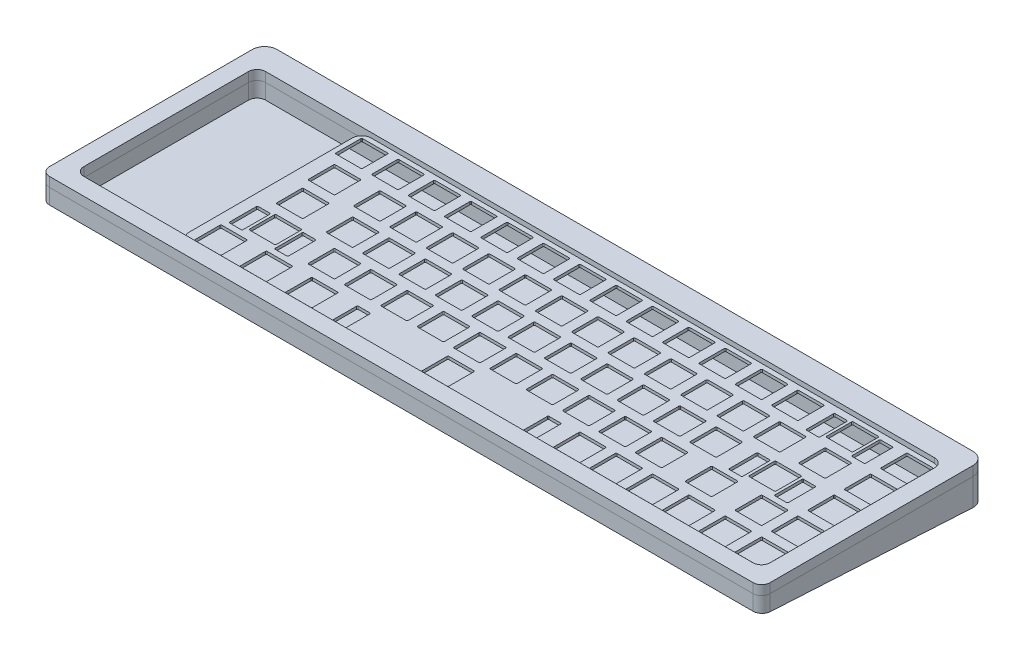
from build123d import *

# Parameters (mm, degrees)
BOSS_EXTRUDE1_DEPTH = 13
SKETCH4_W           = 377.65
SKETCH4_H           = 117.25
BOSS_EXTRUDE3_DEPTH = 10.5
CUT_EXTRUDE3_DEPTH  = 400
FILLET1_R           = 6.5
FILLET4_R           = 4.5
FILLET2_R           = 4.5
SKETCH10_W          = 25
SKETCH10_H          = 7
SKETCH10_H_2        = 7.5
CUT_EXTRUDE2_DEPTH  = 2.5
FILLET3_R           = 4.5
SKETCH9_R           = 1
BOSS_EXTRUDE4_DEPTH = 1.5


with BuildPart() as part:
    # Sketch2 → Boss-Extrude1 (new body)
    with BuildSketch(Plane(origin=(0, 0, 0), x_dir=(1, 0, 0), z_dir=(0, 1, 0))):
        Polygon((-188.825, 60.625), (-188.825, 54.625), (-188.825, -56.625), (188.825, -56.625), (188.825, 60.625), (-182.825, 60.625), align=None)
        Polygon((-179.825, -46.625), (-179.825, 46.625), (-179.825, 47.625), (-178.825, 47.625), (178.825, 47.625), (179.825, 47.625), (179.825, 46.625), (179.825, -46.625), (179.825, -47.625), (178.825, -47.625), (-178.825, -47.625), (-179.825, -47.625), align=None, mode=Mode.SUBTRACT)
    extrude(amount=BOSS_EXTRUDE1_DEPTH)

    # Sketch4 → Boss-Extrude3 (add)
    with BuildSketch(Plane.XZ):
        with Locations((0, -2)):
            Rectangle(SKETCH4_W, SKETCH4_H)
    extrude(amount=BOSS_EXTRUDE3_DEPTH)

    # Sketch12 → Cut-Extrude3 (cut)
    with BuildSketch(Plane.ZY.offset(188.825)):
        Polygon((-60.625, -10.5), (-60.625, -6.5), (56.625, 0), (56.625, -10.5), align=None)
    extrude(amount=-CUT_EXTRUDE3_DEPTH, mode=Mode.SUBTRACT)

    # Fillet1
    fillet1_edges = [part.edges().sort_by_distance(p)[0] for p in [
        (188.825, 3.25, -60.625),
        (-188.825, 3.25, -60.625),
    ]]
    fillet(fillet1_edges, radius=FILLET1_R)

    # Fillet4
    fillet4_edges = [part.edges().sort_by_distance(p)[0] for p in [
        (188.825, 6.5, 56.625),
        (-188.825, 6.5, 56.625),
    ]]
    fillet(fillet4_edges, radius=FILLET4_R)

    # Fillet2
    fillet2_edges = [part.edges().sort_by_distance(p)[0] for p in [
        (179.825, 6.5, 47.625),
        (-179.825, 6.5, 47.625),
        (179.825, 6.5, -47.625),
        (-179.825, 6.5, -47.625),
    ]]
    fillet(fillet2_edges, radius=FILLET2_R)


with BuildPart() as body_2:
    # Split1: the piece on the far side of the plane
    add(part.part)
    split(bisect_by=Plane.ZX.offset(8), keep=Keep.BOTTOM)


with BuildPart() as part_1:
    add(part.part)

    # Split1
    split(bisect_by=Plane.ZX.offset(8), keep=Keep.TOP)

    # Sketch10 → Cut-Extrude2 (cut)
    with BuildSketch(Plane(origin=(0, 8, 0), x_dir=(1, 0, 0), z_dir=(0, 1, 0))):
        Polygon((-108.245613046, 55.125), (-108.245613046, 47.625), (-83.245613046, 47.625), (-83.245613046, 55.125), (-90.245613046, 55.125), align=None)
        with Locations((-93.199035781, -51.125)):
            Rectangle(SKETCH10_W, SKETCH10_H)
        with Locations((-15.745613046, 51.375)):
            Rectangle(SKETCH10_W, SKETCH10_H_2)
        with Locations((-13.199035781, -51.125)):
            Rectangle(SKETCH10_W, SKETCH10_H)
        with Locations((64.254386954, 51.375)):
            Rectangle(SKETCH10_W, SKETCH10_H_2)
        with Locations((66.800964219, -51.125)):
            Rectangle(SKETCH10_W, SKETCH10_H)
        with Locations((144.254386954, 51.375)):
            Rectangle(SKETCH10_W, SKETCH10_H_2)
        with Locations((146.800964219, -51.125)):
            Rectangle(SKETCH10_W, SKETCH10_H)
    extrude(amount=CUT_EXTRUDE2_DEPTH, mode=Mode.SUBTRACT)

    # Fillet3
    fillet3_edges = [part_1.edges().sort_by_distance(p)[0] for p in [
        (-108.245613046, 9.25, -55.125),
        (-28.245613046, 9.25, -55.125),
        (-3.245613046, 9.25, -55.125),
        (-83.245613046, 9.25, -55.125),
        (76.754386954, 9.25, -55.125),
        (51.754386954, 9.25, -55.125),
        (131.754386954, 9.25, -55.125),
        (156.754386954, 9.25, -55.125),
        (134.300964219, 9.25, 54.625),
        (159.300964219, 9.25, 54.625),
        (79.300964219, 9.25, 54.625),
        (54.300964219, 9.25, 54.625),
        (-25.699035781, 9.25, 54.625),
        (-0.699035781, 9.25, 54.625),
        (-80.699035781, 9.25, 54.625),
        (-105.699035781, 9.25, 54.625),
    ]]
    fillet(fillet3_edges, radius=FILLET3_R)


with BuildPart() as body_3:
    # Sketch9 → Boss-Extrude4 (new body)
    with BuildSketch(Plane(origin=(0, 0, 0), x_dir=(1, 0, 0), z_dir=(0, 1, 0))):
        with BuildLine():
            Line((-103.245613046, 47.625), (-119.970321887, 47.625))
            ThreePointArc((-119.970321887, 47.625), (-123.505855793, 46.160533906), (-124.970321887, 42.625))
            Line((-124.970321887, 42.625), (-124.970321887, -42.625))
            ThreePointArc((-124.970321887, -42.625), (-123.505855793, -46.160533906), (-119.970321887, -47.625))
            Line((-119.970321887, -47.625), (-100.699035781, -47.625))
            Line((-100.699035781, -47.625), (-100.699035781, -52.625))
            ThreePointArc((-100.699035781, -52.625), (-100.113249344, -54.039213562), (-98.699035781, -54.625))
            Line((-98.699035781, -54.625), (-87.699035781, -54.625))
            ThreePointArc((-87.699035781, -54.625), (-86.284822219, -54.039213562), (-85.699035781, -52.625))
            Line((-85.699035781, -52.625), (-85.699035781, -47.625))
            Line((-85.699035781, -47.625), (-20.699035781, -47.625))
            Line((-20.699035781, -47.625), (-20.699035781, -52.625))
            ThreePointArc((-20.699035781, -52.625), (-20.113249344, -54.039213562), (-18.699035781, -54.625))
            Line((-18.699035781, -54.625), (-7.699035781, -54.625))
            ThreePointArc((-7.699035781, -54.625), (-6.284822219, -54.039213562), (-5.699035781, -52.625))
            Line((-5.699035781, -52.625), (-5.699035781, -47.625))
            Line((-5.699035781, -47.625), (59.300964219, -47.625))
            Line((59.300964219, -47.625), (59.300964219, -52.625))
            ThreePointArc((59.300964219, -52.625), (59.886750656, -54.039213562), (61.300964219, -54.625))
            Line((61.300964219, -54.625), (72.300964219, -54.625))
            ThreePointArc((72.300964219, -54.625), (73.715177781, -54.039213562), (74.300964219, -52.625))
            Line((74.300964219, -52.625), (74.300964219, -47.625))
            Line((74.300964219, -47.625), (139.300964219, -47.625))
            Line((139.300964219, -47.625), (139.300964219, -52.625))
            ThreePointArc((139.300964219, -52.625), (139.886750656, -54.039213562), (141.300964219, -54.625))
            Line((141.300964219, -54.625), (152.300964219, -54.625))
            ThreePointArc((152.300964219, -54.625), (153.715177781, -54.039213562), (154.300964219, -52.625))
            Line((154.300964219, -52.625), (154.300964219, -47.625))
            Line((154.300964219, -47.625), (174.829678113, -47.625))
            ThreePointArc((174.829678113, -47.625), (178.287915068, -46.2361767), (179.825, -42.841238864))
            Line((179.825, -42.841238864), (179.825, 42.841238864))
            ThreePointArc((179.825, 42.841238864), (178.287915068, 46.2361767), (174.829678113, 47.625))
            Line((174.829678113, 47.625), (151.754386954, 47.625))
            Line((151.754386954, 47.625), (151.754386954, 53.125))
            ThreePointArc((151.754386954, 53.125), (151.168600516, 54.539213562), (149.754386954, 55.125))
            Line((149.754386954, 55.125), (138.754386954, 55.125))
            ThreePointArc((138.754386954, 55.125), (137.340173391, 54.539213562), (136.754386954, 53.125))
            Line((136.754386954, 53.125), (136.754386954, 47.625))
            Line((136.754386954, 47.625), (71.754386954, 47.625))
            Line((71.754386954, 47.625), (71.754386954, 53.125))
            ThreePointArc((71.754386954, 53.125), (71.168600516, 54.539213562), (69.754386954, 55.125))
            Line((69.754386954, 55.125), (58.754386954, 55.125))
            ThreePointArc((58.754386954, 55.125), (57.340173391, 54.539213562), (56.754386954, 53.125))
            Line((56.754386954, 53.125), (56.754386954, 47.625))
            Line((56.754386954, 47.625), (-8.245613046, 47.625))
            Line((-8.245613046, 47.625), (-8.245613046, 53.125))
            ThreePointArc((-8.245613046, 53.125), (-8.831399484, 54.539213562), (-10.245613046, 55.125))
            Line((-10.245613046, 55.125), (-21.245613046, 55.125))
            ThreePointArc((-21.245613046, 55.125), (-22.659826609, 54.539213562), (-23.245613046, 53.125))
            Line((-23.245613046, 53.125), (-23.245613046, 47.625))
            Line((-23.245613046, 47.625), (-88.245613046, 47.625))
            Line((-88.245613046, 47.625), (-88.245613046, 53.125))
            ThreePointArc((-88.245613046, 53.125), (-88.831399484, 54.539213562), (-90.245613046, 55.125))
            Line((-90.245613046, 55.125), (-101.245613046, 55.125))
            ThreePointArc((-101.245613046, 55.125), (-102.659826609, 54.539213562), (-103.245613046, 53.125))
            Line((-103.245613046, 53.125), (-103.245613046, 47.625))
        make_face()
        with BuildLine():
            ThreePointArc((-120.064071887, -31.6), (-119.917625277, -31.246446609), (-119.564071887, -31.1))
            Line((-119.564071887, -31.1), (-106.564071887, -31.1))
            ThreePointArc((-106.564071887, -31.1), (-106.210518496, -31.246446609), (-106.064071887, -31.6))
            Line((-106.064071887, -31.6), (-106.064071887, -44.6))
            ThreePointArc((-106.064071887, -44.6), (-106.210518496, -44.953553391), (-106.564071887, -45.1))
            Line((-106.564071887, -45.1), (-119.564071887, -45.1))
            ThreePointArc((-119.564071887, -45.1), (-119.917625277, -44.953553391), (-120.064071887, -44.6))
            Line((-120.064071887, -44.6), (-120.064071887, -31.6))
        make_face(mode=Mode.SUBTRACT)
        with BuildLine():
            ThreePointArc((-96.251571887, -31.6), (-96.105125277, -31.246446609), (-95.751571887, -31.1))
            Line((-95.751571887, -31.1), (-82.751571887, -31.1))
            ThreePointArc((-82.751571887, -31.1), (-82.398018496, -31.246446609), (-82.251571887, -31.6))
            Line((-82.251571887, -31.6), (-82.251571887, -44.6))
            ThreePointArc((-82.251571887, -44.6), (-82.398018496, -44.953553391), (-82.751571887, -45.1))
            Line((-82.751571887, -45.1), (-95.751571887, -45.1))
            ThreePointArc((-95.751571887, -45.1), (-96.105125277, -44.953553391), (-96.251571887, -44.6))
            Line((-96.251571887, -44.6), (-96.251571887, -31.6))
        make_face(mode=Mode.SUBTRACT)
        with BuildLine():
            ThreePointArc((-72.439071887, -31.6), (-72.292625277, -31.246446609), (-71.939071887, -31.1))
            Line((-71.939071887, -31.1), (-58.939071887, -31.1))
            ThreePointArc((-58.939071887, -31.1), (-58.585518496, -31.246446609), (-58.439071887, -31.6))
            Line((-58.439071887, -31.6), (-58.439071887, -44.6))
            ThreePointArc((-58.439071887, -44.6), (-58.585518496, -44.953553391), (-58.939071887, -45.1))
            Line((-58.939071887, -45.1), (-71.939071887, -45.1))
            ThreePointArc((-71.939071887, -45.1), (-72.292625277, -44.953553391), (-72.439071887, -44.6))
            Line((-72.439071887, -44.6), (-72.439071887, -31.6))
        make_face(mode=Mode.SUBTRACT)
        with BuildLine():
            ThreePointArc((-47.501571887, -32.6), (-47.355125277, -32.246446609), (-47.001571887, -32.1))
            Line((-47.001571887, -32.1), (-41.001571887, -32.1))
            ThreePointArc((-41.001571887, -32.1), (-40.648018496, -32.246446609), (-40.501571887, -32.6))
            Line((-40.501571887, -32.6), (-40.501571887, -46.6))
            ThreePointArc((-40.501571887, -46.6), (-40.648018496, -46.953553391), (-41.001571887, -47.1))
            Line((-41.001571887, -47.1), (-47.001571887, -47.1))
            ThreePointArc((-47.001571887, -47.1), (-47.355125277, -46.953553391), (-47.501571887, -46.6))
            Line((-47.501571887, -46.6), (-47.501571887, -32.6))
        make_face(mode=Mode.SUBTRACT)
        with BuildLine():
            ThreePointArc((-1.001571887, -31.6), (-0.855125277, -31.246446609), (-0.501571887, -31.1))
            Line((-0.501571887, -31.1), (12.498428113, -31.1))
            ThreePointArc((12.498428113, -31.1), (12.851981504, -31.246446609), (12.998428113, -31.6))
            Line((12.998428113, -31.6), (12.998428113, -44.6))
            ThreePointArc((12.998428113, -44.6), (12.851981504, -44.953553391), (12.498428113, -45.1))
            Line((12.498428113, -45.1), (-0.501571887, -45.1))
            ThreePointArc((-0.501571887, -45.1), (-0.855125277, -44.953553391), (-1.001571887, -44.6))
            Line((-1.001571887, -44.6), (-1.001571887, -31.6))
        make_face(mode=Mode.SUBTRACT)
        with BuildLine():
            ThreePointArc((-118.977071887, -13.55), (-118.830625277, -13.196446609), (-118.477071887, -13.05))
            Line((-118.477071887, -13.05), (-112.477071887, -13.05))
            ThreePointArc((-112.477071887, -13.05), (-112.123518496, -13.196446609), (-111.977071887, -13.55))
            Line((-111.977071887, -13.55), (-111.977071887, -27.55))
            ThreePointArc((-111.977071887, -27.55), (-112.123518496, -27.903553391), (-112.477071887, -28.05))
            Line((-112.477071887, -28.05), (-118.477071887, -28.05))
            ThreePointArc((-118.477071887, -28.05), (-118.830625277, -27.903553391), (-118.977071887, -27.55))
            Line((-118.977071887, -27.55), (-118.977071887, -13.55))
        make_face(mode=Mode.SUBTRACT)
        with BuildLine():
            ThreePointArc((-95.101071887, -13.55), (-94.954625277, -13.196446609), (-94.601071887, -13.05))
            Line((-94.601071887, -13.05), (-88.601071887, -13.05))
            ThreePointArc((-88.601071887, -13.05), (-88.247518496, -13.196446609), (-88.101071887, -13.55))
            Line((-88.101071887, -13.55), (-88.101071887, -27.55))
            ThreePointArc((-88.101071887, -27.55), (-88.247518496, -27.903553391), (-88.601071887, -28.05))
            Line((-88.601071887, -28.05), (-94.601071887, -28.05))
            ThreePointArc((-94.601071887, -28.05), (-94.954625277, -27.903553391), (-95.101071887, -27.55))
            Line((-95.101071887, -27.55), (-95.101071887, -13.55))
        make_face(mode=Mode.SUBTRACT)
        with BuildLine():
            ThreePointArc((-110.539071887, -12.55), (-110.392625277, -12.196446609), (-110.039071887, -12.05))
            Line((-110.039071887, -12.05), (-97.039071887, -12.05))
            ThreePointArc((-97.039071887, -12.05), (-96.685518496, -12.196446609), (-96.539071887, -12.55))
            Line((-96.539071887, -12.55), (-96.539071887, -25.55))
            ThreePointArc((-96.539071887, -25.55), (-96.685518496, -25.903553391), (-97.039071887, -26.05))
            Line((-97.039071887, -26.05), (-110.039071887, -26.05))
            ThreePointArc((-110.039071887, -26.05), (-110.392625277, -25.903553391), (-110.539071887, -25.55))
            Line((-110.539071887, -25.55), (-110.539071887, -12.55))
        make_face(mode=Mode.SUBTRACT)
        with BuildLine():
            ThreePointArc((-79.582821887, -12.55), (-79.436375277, -12.196446609), (-79.082821887, -12.05))
            Line((-79.082821887, -12.05), (-66.082821887, -12.05))
            ThreePointArc((-66.082821887, -12.05), (-65.729268496, -12.196446609), (-65.582821887, -12.55))
            Line((-65.582821887, -12.55), (-65.582821887, -25.55))
            ThreePointArc((-65.582821887, -25.55), (-65.729268496, -25.903553391), (-66.082821887, -26.05))
            Line((-66.082821887, -26.05), (-79.082821887, -26.05))
            ThreePointArc((-79.082821887, -26.05), (-79.436375277, -25.903553391), (-79.582821887, -25.55))
            Line((-79.582821887, -25.55), (-79.582821887, -12.55))
        make_face(mode=Mode.SUBTRACT)
        with BuildLine():
            ThreePointArc((-60.532821887, -12.55), (-60.386375277, -12.196446609), (-60.032821887, -12.05))
            Line((-60.032821887, -12.05), (-47.032821887, -12.05))
            ThreePointArc((-47.032821887, -12.05), (-46.679268496, -12.196446609), (-46.532821887, -12.55))
            Line((-46.532821887, -12.55), (-46.532821887, -25.55))
            ThreePointArc((-46.532821887, -25.55), (-46.679268496, -25.903553391), (-47.032821887, -26.05))
            Line((-47.032821887, -26.05), (-60.032821887, -26.05))
            ThreePointArc((-60.032821887, -26.05), (-60.386375277, -25.903553391), (-60.532821887, -25.55))
            Line((-60.532821887, -25.55), (-60.532821887, -12.55))
        make_face(mode=Mode.SUBTRACT)
        with BuildLine():
            ThreePointArc((-115.301571887, 6.5), (-115.155125277, 6.853553391), (-114.801571887, 7))
            Line((-114.801571887, 7), (-101.801571887, 7))
            ThreePointArc((-101.801571887, 7), (-101.448018496, 6.853553391), (-101.301571887, 6.5))
            Line((-101.301571887, 6.5), (-101.301571887, -6.5))
            ThreePointArc((-101.301571887, -6.5), (-101.448018496, -6.853553391), (-101.801571887, -7))
            Line((-101.801571887, -7), (-114.801571887, -7))
            ThreePointArc((-114.801571887, -7), (-115.155125277, -6.853553391), (-115.301571887, -6.5))
            Line((-115.301571887, -6.5), (-115.301571887, 6.5))
        make_face(mode=Mode.SUBTRACT)
        with BuildLine():
            ThreePointArc((-89.107821887, 6.5), (-88.961375277, 6.853553391), (-88.607821887, 7))
            Line((-88.607821887, 7), (-75.607821887, 7))
            ThreePointArc((-75.607821887, 7), (-75.254268496, 6.853553391), (-75.107821887, 6.5))
            Line((-75.107821887, 6.5), (-75.107821887, -6.5))
            ThreePointArc((-75.107821887, -6.5), (-75.254268496, -6.853553391), (-75.607821887, -7))
            Line((-75.607821887, -7), (-88.607821887, -7))
            ThreePointArc((-88.607821887, -7), (-88.961375277, -6.853553391), (-89.107821887, -6.5))
            Line((-89.107821887, -6.5), (-89.107821887, 6.5))
        make_face(mode=Mode.SUBTRACT)
        with BuildLine():
            ThreePointArc((-70.057821887, 6.5), (-69.911375277, 6.853553391), (-69.557821887, 7))
            Line((-69.557821887, 7), (-56.557821887, 7))
            ThreePointArc((-56.557821887, 7), (-56.204268496, 6.853553391), (-56.057821887, 6.5))
            Line((-56.057821887, 6.5), (-56.057821887, -6.5))
            ThreePointArc((-56.057821887, -6.5), (-56.204268496, -6.853553391), (-56.557821887, -7))
            Line((-56.557821887, -7), (-69.557821887, -7))
            ThreePointArc((-69.557821887, -7), (-69.911375277, -6.853553391), (-70.057821887, -6.5))
            Line((-70.057821887, -6.5), (-70.057821887, 6.5))
        make_face(mode=Mode.SUBTRACT)
        with BuildLine():
            ThreePointArc((-41.482821887, -12.55), (-41.336375277, -12.196446609), (-40.982821887, -12.05))
            Line((-40.982821887, -12.05), (-27.982821887, -12.05))
            ThreePointArc((-27.982821887, -12.05), (-27.629268496, -12.196446609), (-27.482821887, -12.55))
            Line((-27.482821887, -12.55), (-27.482821887, -25.55))
            ThreePointArc((-27.482821887, -25.55), (-27.629268496, -25.903553391), (-27.982821887, -26.05))
            Line((-27.982821887, -26.05), (-40.982821887, -26.05))
            ThreePointArc((-40.982821887, -26.05), (-41.336375277, -25.903553391), (-41.482821887, -25.55))
            Line((-41.482821887, -25.55), (-41.482821887, -12.55))
        make_face(mode=Mode.SUBTRACT)
        with BuildLine():
            ThreePointArc((-22.432821887, -12.55), (-22.286375277, -12.196446609), (-21.932821887, -12.05))
            Line((-21.932821887, -12.05), (-8.932821887, -12.05))
            ThreePointArc((-8.932821887, -12.05), (-8.579268496, -12.196446609), (-8.432821887, -12.55))
            Line((-8.432821887, -12.55), (-8.432821887, -25.55))
            ThreePointArc((-8.432821887, -25.55), (-8.579268496, -25.903553391), (-8.932821887, -26.05))
            Line((-8.932821887, -26.05), (-21.932821887, -26.05))
            ThreePointArc((-21.932821887, -26.05), (-22.286375277, -25.903553391), (-22.432821887, -25.55))
            Line((-22.432821887, -25.55), (-22.432821887, -12.55))
        make_face(mode=Mode.SUBTRACT)
        with BuildLine():
            ThreePointArc((-3.382821887, -12.55), (-3.236375277, -12.196446609), (-2.882821887, -12.05))
            Line((-2.882821887, -12.05), (10.117178113, -12.05))
            ThreePointArc((10.117178113, -12.05), (10.470731504, -12.196446609), (10.617178113, -12.55))
            Line((10.617178113, -12.55), (10.617178113, -25.55))
            ThreePointArc((10.617178113, -25.55), (10.470731504, -25.903553391), (10.117178113, -26.05))
            Line((10.117178113, -26.05), (-2.882821887, -26.05))
            ThreePointArc((-2.882821887, -26.05), (-3.236375277, -25.903553391), (-3.382821887, -25.55))
            Line((-3.382821887, -25.55), (-3.382821887, -12.55))
        make_face(mode=Mode.SUBTRACT)
        with BuildLine():
            ThreePointArc((15.667178113, -12.55), (15.813624723, -12.196446609), (16.167178113, -12.05))
            Line((16.167178113, -12.05), (29.167178113, -12.05))
            ThreePointArc((29.167178113, -12.05), (29.520731504, -12.196446609), (29.667178113, -12.55))
            Line((29.667178113, -12.55), (29.667178113, -25.55))
            ThreePointArc((29.667178113, -25.55), (29.520731504, -25.903553391), (29.167178113, -26.05))
            Line((29.167178113, -26.05), (16.167178113, -26.05))
            ThreePointArc((16.167178113, -26.05), (15.813624723, -25.903553391), (15.667178113, -25.55))
            Line((15.667178113, -25.55), (15.667178113, -12.55))
        make_face(mode=Mode.SUBTRACT)
        with BuildLine():
            ThreePointArc((-51.007821887, 6.5), (-50.861375277, 6.853553391), (-50.507821887, 7))
            Line((-50.507821887, 7), (-37.507821887, 7))
            ThreePointArc((-37.507821887, 7), (-37.154268496, 6.853553391), (-37.007821887, 6.5))
            Line((-37.007821887, 6.5), (-37.007821887, -6.5))
            ThreePointArc((-37.007821887, -6.5), (-37.154268496, -6.853553391), (-37.507821887, -7))
            Line((-37.507821887, -7), (-50.507821887, -7))
            ThreePointArc((-50.507821887, -7), (-50.861375277, -6.853553391), (-51.007821887, -6.5))
            Line((-51.007821887, -6.5), (-51.007821887, 6.5))
        make_face(mode=Mode.SUBTRACT)
        with BuildLine():
            ThreePointArc((-31.957821887, 6.5), (-31.811375277, 6.853553391), (-31.457821887, 7))
            Line((-31.457821887, 7), (-18.457821887, 7))
            ThreePointArc((-18.457821887, 7), (-18.104268496, 6.853553391), (-17.957821887, 6.5))
            Line((-17.957821887, 6.5), (-17.957821887, -6.5))
            ThreePointArc((-17.957821887, -6.5), (-18.104268496, -6.853553391), (-18.457821887, -7))
            Line((-18.457821887, -7), (-31.457821887, -7))
            ThreePointArc((-31.457821887, -7), (-31.811375277, -6.853553391), (-31.957821887, -6.5))
            Line((-31.957821887, -6.5), (-31.957821887, 6.5))
        make_face(mode=Mode.SUBTRACT)
        with BuildLine():
            ThreePointArc((-12.907821887, 6.5), (-12.761375277, 6.853553391), (-12.407821887, 7))
            Line((-12.407821887, 7), (0.592178113, 7))
            ThreePointArc((0.592178113, 7), (0.945731504, 6.853553391), (1.092178113, 6.5))
            Line((1.092178113, 6.5), (1.092178113, -6.5))
            ThreePointArc((1.092178113, -6.5), (0.945731504, -6.853553391), (0.592178113, -7))
            Line((0.592178113, -7), (-12.407821887, -7))
            ThreePointArc((-12.407821887, -7), (-12.761375277, -6.853553391), (-12.907821887, -6.5))
            Line((-12.907821887, -6.5), (-12.907821887, 6.5))
        make_face(mode=Mode.SUBTRACT)
        with BuildLine():
            ThreePointArc((6.142178113, 6.5), (6.288624723, 6.853553391), (6.642178113, 7))
            Line((6.642178113, 7), (19.642178113, 7))
            ThreePointArc((19.642178113, 7), (19.995731504, 6.853553391), (20.142178113, 6.5))
            Line((20.142178113, 6.5), (20.142178113, -6.5))
            ThreePointArc((20.142178113, -6.5), (19.995731504, -6.853553391), (19.642178113, -7))
            Line((19.642178113, -7), (6.642178113, -7))
            ThreePointArc((6.642178113, -7), (6.288624723, -6.853553391), (6.142178113, -6.5))
            Line((6.142178113, -6.5), (6.142178113, 6.5))
        make_face(mode=Mode.SUBTRACT)
        with BuildLine():
            ThreePointArc((52.498428113, -32.6), (52.644874723, -32.246446609), (52.998428113, -32.1))
            Line((52.998428113, -32.1), (58.998428113, -32.1))
            ThreePointArc((58.998428113, -32.1), (59.351981504, -32.246446609), (59.498428113, -32.6))
            Line((59.498428113, -32.6), (59.498428113, -46.6))
            ThreePointArc((59.498428113, -46.6), (59.351981504, -46.953553391), (58.998428113, -47.1))
            Line((58.998428113, -47.1), (52.998428113, -47.1))
            ThreePointArc((52.998428113, -47.1), (52.644874723, -46.953553391), (52.498428113, -46.6))
            Line((52.498428113, -46.6), (52.498428113, -32.6))
        make_face(mode=Mode.SUBTRACT)
        with BuildLine():
            ThreePointArc((68.054678113, -31.6), (68.201124723, -31.246446609), (68.554678113, -31.1))
            Line((68.554678113, -31.1), (81.554678113, -31.1))
            ThreePointArc((81.554678113, -31.1), (81.908231504, -31.246446609), (82.054678113, -31.6))
            Line((82.054678113, -31.6), (82.054678113, -44.6))
            ThreePointArc((82.054678113, -44.6), (81.908231504, -44.953553391), (81.554678113, -45.1))
            Line((81.554678113, -45.1), (68.554678113, -45.1))
            ThreePointArc((68.554678113, -45.1), (68.201124723, -44.953553391), (68.054678113, -44.6))
            Line((68.054678113, -44.6), (68.054678113, -31.6))
        make_face(mode=Mode.SUBTRACT)
        with BuildLine():
            ThreePointArc((87.104678113, -31.6), (87.251124723, -31.246446609), (87.604678113, -31.1))
            Line((87.604678113, -31.1), (100.604678113, -31.1))
            ThreePointArc((100.604678113, -31.1), (100.958231504, -31.246446609), (101.104678113, -31.6))
            Line((101.104678113, -31.6), (101.104678113, -44.6))
            ThreePointArc((101.104678113, -44.6), (100.958231504, -44.953553391), (100.604678113, -45.1))
            Line((100.604678113, -45.1), (87.604678113, -45.1))
            ThreePointArc((87.604678113, -45.1), (87.251124723, -44.953553391), (87.104678113, -44.6))
            Line((87.104678113, -44.6), (87.104678113, -31.6))
        make_face(mode=Mode.SUBTRACT)
        with BuildLine():
            ThreePointArc((106.154678113, -31.6), (106.301124723, -31.246446609), (106.654678113, -31.1))
            Line((106.654678113, -31.1), (119.654678113, -31.1))
            ThreePointArc((119.654678113, -31.1), (120.008231504, -31.246446609), (120.154678113, -31.6))
            Line((120.154678113, -31.6), (120.154678113, -44.6))
            ThreePointArc((120.154678113, -44.6), (120.008231504, -44.953553391), (119.654678113, -45.1))
            Line((119.654678113, -45.1), (106.654678113, -45.1))
            ThreePointArc((106.654678113, -45.1), (106.301124723, -44.953553391), (106.154678113, -44.6))
            Line((106.154678113, -44.6), (106.154678113, -31.6))
        make_face(mode=Mode.SUBTRACT)
        with BuildLine():
            ThreePointArc((125.204678113, -31.6), (125.351124723, -31.246446609), (125.704678113, -31.1))
            Line((125.704678113, -31.1), (138.704678113, -31.1))
            ThreePointArc((138.704678113, -31.1), (139.058231504, -31.246446609), (139.204678113, -31.6))
            Line((139.204678113, -31.6), (139.204678113, -44.6))
            ThreePointArc((139.204678113, -44.6), (139.058231504, -44.953553391), (138.704678113, -45.1))
            Line((138.704678113, -45.1), (125.704678113, -45.1))
            ThreePointArc((125.704678113, -45.1), (125.351124723, -44.953553391), (125.204678113, -44.6))
            Line((125.204678113, -44.6), (125.204678113, -31.6))
        make_face(mode=Mode.SUBTRACT)
        with BuildLine():
            ThreePointArc((144.254678113, -31.6), (144.401124723, -31.246446609), (144.754678113, -31.1))
            Line((144.754678113, -31.1), (157.754678113, -31.1))
            ThreePointArc((157.754678113, -31.1), (158.108231504, -31.246446609), (158.254678113, -31.6))
            Line((158.254678113, -31.6), (158.254678113, -44.6))
            ThreePointArc((158.254678113, -44.6), (158.108231504, -44.953553391), (157.754678113, -45.1))
            Line((157.754678113, -45.1), (144.754678113, -45.1))
            ThreePointArc((144.754678113, -45.1), (144.401124723, -44.953553391), (144.254678113, -44.6))
            Line((144.254678113, -44.6), (144.254678113, -31.6))
        make_face(mode=Mode.SUBTRACT)
        with BuildLine():
            ThreePointArc((163.304678113, -31.6), (163.451124723, -31.246446609), (163.804678113, -31.1))
            Line((163.804678113, -31.1), (176.804678113, -31.1))
            ThreePointArc((176.804678113, -31.1), (177.158231504, -31.246446609), (177.304678113, -31.6))
            Line((177.304678113, -31.6), (177.304678113, -44.6))
            ThreePointArc((177.304678113, -44.6), (177.158231504, -44.953553391), (176.804678113, -45.1))
            Line((176.804678113, -45.1), (163.804678113, -45.1))
            ThreePointArc((163.804678113, -45.1), (163.451124723, -44.953553391), (163.304678113, -44.6))
            Line((163.304678113, -44.6), (163.304678113, -31.6))
        make_face(mode=Mode.SUBTRACT)
        with BuildLine():
            ThreePointArc((34.717178113, -12.55), (34.863624723, -12.196446609), (35.217178113, -12.05))
            Line((35.217178113, -12.05), (48.217178113, -12.05))
            ThreePointArc((48.217178113, -12.05), (48.570731504, -12.196446609), (48.717178113, -12.55))
            Line((48.717178113, -12.55), (48.717178113, -25.55))
            ThreePointArc((48.717178113, -25.55), (48.570731504, -25.903553391), (48.217178113, -26.05))
            Line((48.217178113, -26.05), (35.217178113, -26.05))
            ThreePointArc((35.217178113, -26.05), (34.863624723, -25.903553391), (34.717178113, -25.55))
            Line((34.717178113, -25.55), (34.717178113, -12.55))
        make_face(mode=Mode.SUBTRACT)
        with BuildLine():
            ThreePointArc((53.767178113, -12.55), (53.913624723, -12.196446609), (54.267178113, -12.05))
            Line((54.267178113, -12.05), (67.267178113, -12.05))
            ThreePointArc((67.267178113, -12.05), (67.620731504, -12.196446609), (67.767178113, -12.55))
            Line((67.767178113, -12.55), (67.767178113, -25.55))
            ThreePointArc((67.767178113, -25.55), (67.620731504, -25.903553391), (67.267178113, -26.05))
            Line((67.267178113, -26.05), (54.267178113, -26.05))
            ThreePointArc((54.267178113, -26.05), (53.913624723, -25.903553391), (53.767178113, -25.55))
            Line((53.767178113, -25.55), (53.767178113, -12.55))
        make_face(mode=Mode.SUBTRACT)
        with BuildLine():
            ThreePointArc((72.817178113, -12.55), (72.963624723, -12.196446609), (73.317178113, -12.05))
            Line((73.317178113, -12.05), (86.317178113, -12.05))
            ThreePointArc((86.317178113, -12.05), (86.670731504, -12.196446609), (86.817178113, -12.55))
            Line((86.817178113, -12.55), (86.817178113, -25.55))
            ThreePointArc((86.817178113, -25.55), (86.670731504, -25.903553391), (86.317178113, -26.05))
            Line((86.317178113, -26.05), (73.317178113, -26.05))
            ThreePointArc((73.317178113, -26.05), (72.963624723, -25.903553391), (72.817178113, -25.55))
            Line((72.817178113, -25.55), (72.817178113, -12.55))
        make_face(mode=Mode.SUBTRACT)
        with BuildLine():
            ThreePointArc((91.867178113, -12.55), (92.013624723, -12.196446609), (92.367178113, -12.05))
            Line((92.367178113, -12.05), (105.367178113, -12.05))
            ThreePointArc((105.367178113, -12.05), (105.720731504, -12.196446609), (105.867178113, -12.55))
            Line((105.867178113, -12.55), (105.867178113, -25.55))
            ThreePointArc((105.867178113, -25.55), (105.720731504, -25.903553391), (105.367178113, -26.05))
            Line((105.367178113, -26.05), (92.367178113, -26.05))
            ThreePointArc((92.367178113, -26.05), (92.013624723, -25.903553391), (91.867178113, -25.55))
            Line((91.867178113, -25.55), (91.867178113, -12.55))
        make_face(mode=Mode.SUBTRACT)
        with BuildLine():
            ThreePointArc((25.192178113, 6.5), (25.338624723, 6.853553391), (25.692178113, 7))
            Line((25.692178113, 7), (38.692178113, 7))
            ThreePointArc((38.692178113, 7), (39.045731504, 6.853553391), (39.192178113, 6.5))
            Line((39.192178113, 6.5), (39.192178113, -6.5))
            ThreePointArc((39.192178113, -6.5), (39.045731504, -6.853553391), (38.692178113, -7))
            Line((38.692178113, -7), (25.692178113, -7))
            ThreePointArc((25.692178113, -7), (25.338624723, -6.853553391), (25.192178113, -6.5))
            Line((25.192178113, -6.5), (25.192178113, 6.5))
        make_face(mode=Mode.SUBTRACT)
        with BuildLine():
            ThreePointArc((44.242178113, 6.5), (44.388624723, 6.853553391), (44.742178113, 7))
            Line((44.742178113, 7), (57.742178113, 7))
            ThreePointArc((57.742178113, 7), (58.095731504, 6.853553391), (58.242178113, 6.5))
            Line((58.242178113, 6.5), (58.242178113, -6.5))
            ThreePointArc((58.242178113, -6.5), (58.095731504, -6.853553391), (57.742178113, -7))
            Line((57.742178113, -7), (44.742178113, -7))
            ThreePointArc((44.742178113, -7), (44.388624723, -6.853553391), (44.242178113, -6.5))
            Line((44.242178113, -6.5), (44.242178113, 6.5))
        make_face(mode=Mode.SUBTRACT)
        with BuildLine():
            ThreePointArc((63.292178113, 6.5), (63.438624723, 6.853553391), (63.792178113, 7))
            Line((63.792178113, 7), (76.792178113, 7))
            ThreePointArc((76.792178113, 7), (77.145731504, 6.853553391), (77.292178113, 6.5))
            Line((77.292178113, 6.5), (77.292178113, -6.5))
            ThreePointArc((77.292178113, -6.5), (77.145731504, -6.853553391), (76.792178113, -7))
            Line((76.792178113, -7), (63.792178113, -7))
            ThreePointArc((63.792178113, -7), (63.438624723, -6.853553391), (63.292178113, -6.5))
            Line((63.292178113, -6.5), (63.292178113, 6.5))
        make_face(mode=Mode.SUBTRACT)
        with BuildLine():
            ThreePointArc((82.342178113, 6.5), (82.488624723, 6.853553391), (82.842178113, 7))
            Line((82.842178113, 7), (95.842178113, 7))
            ThreePointArc((95.842178113, 7), (96.195731504, 6.853553391), (96.342178113, 6.5))
            Line((96.342178113, 6.5), (96.342178113, -6.5))
            ThreePointArc((96.342178113, -6.5), (96.195731504, -6.853553391), (95.842178113, -7))
            Line((95.842178113, -7), (82.842178113, -7))
            ThreePointArc((82.842178113, -7), (82.488624723, -6.853553391), (82.342178113, -6.5))
            Line((82.342178113, -6.5), (82.342178113, 6.5))
        make_face(mode=Mode.SUBTRACT)
        with BuildLine():
            ThreePointArc((118.060928113, -12.55), (118.207374723, -12.196446609), (118.560928113, -12.05))
            Line((118.560928113, -12.05), (131.560928113, -12.05))
            ThreePointArc((131.560928113, -12.05), (131.914481504, -12.196446609), (132.060928113, -12.55))
            Line((132.060928113, -12.55), (132.060928113, -25.55))
            ThreePointArc((132.060928113, -25.55), (131.914481504, -25.903553391), (131.560928113, -26.05))
            Line((131.560928113, -26.05), (118.560928113, -26.05))
            ThreePointArc((118.560928113, -26.05), (118.207374723, -25.903553391), (118.060928113, -25.55))
            Line((118.060928113, -25.55), (118.060928113, -12.55))
        make_face(mode=Mode.SUBTRACT)
        with BuildLine():
            ThreePointArc((144.254678113, -12.55), (144.401124723, -12.196446609), (144.754678113, -12.05))
            Line((144.754678113, -12.05), (157.754678113, -12.05))
            ThreePointArc((157.754678113, -12.05), (158.108231504, -12.196446609), (158.254678113, -12.55))
            Line((158.254678113, -12.55), (158.254678113, -25.55))
            ThreePointArc((158.254678113, -25.55), (158.108231504, -25.903553391), (157.754678113, -26.05))
            Line((157.754678113, -26.05), (144.754678113, -26.05))
            ThreePointArc((144.754678113, -26.05), (144.401124723, -25.903553391), (144.254678113, -25.55))
            Line((144.254678113, -25.55), (144.254678113, -12.55))
        make_face(mode=Mode.SUBTRACT)
        with BuildLine():
            ThreePointArc((163.304678113, -12.55), (163.451124723, -12.196446609), (163.804678113, -12.05))
            Line((163.804678113, -12.05), (176.804678113, -12.05))
            ThreePointArc((176.804678113, -12.05), (177.158231504, -12.196446609), (177.304678113, -12.55))
            Line((177.304678113, -12.55), (177.304678113, -25.55))
            ThreePointArc((177.304678113, -25.55), (177.158231504, -25.903553391), (176.804678113, -26.05))
            Line((176.804678113, -26.05), (163.804678113, -26.05))
            ThreePointArc((163.804678113, -26.05), (163.451124723, -25.903553391), (163.304678113, -25.55))
            Line((163.304678113, -25.55), (163.304678113, -12.55))
        make_face(mode=Mode.SUBTRACT)
        with BuildLine():
            ThreePointArc((101.392178113, 6.5), (101.538624723, 6.853553391), (101.892178113, 7))
            Line((101.892178113, 7), (114.892178113, 7))
            ThreePointArc((114.892178113, 7), (115.245731504, 6.853553391), (115.392178113, 6.5))
            Line((115.392178113, 6.5), (115.392178113, -6.5))
            ThreePointArc((115.392178113, -6.5), (115.245731504, -6.853553391), (114.892178113, -7))
            Line((114.892178113, -7), (101.892178113, -7))
            ThreePointArc((101.892178113, -7), (101.538624723, -6.853553391), (101.392178113, -6.5))
            Line((101.392178113, -6.5), (101.392178113, 6.5))
        make_face(mode=Mode.SUBTRACT)
        with BuildLine():
            ThreePointArc((123.910428113, 5.5), (124.056874723, 5.853553391), (124.410428113, 6))
            Line((124.410428113, 6), (130.410428113, 6))
            ThreePointArc((130.410428113, 6), (130.763981504, 5.853553391), (130.910428113, 5.5))
            Line((130.910428113, 5.5), (130.910428113, -8.5))
            ThreePointArc((130.910428113, -8.5), (130.763981504, -8.853553391), (130.410428113, -9))
            Line((130.410428113, -9), (124.410428113, -9))
            ThreePointArc((124.410428113, -9), (124.056874723, -8.853553391), (123.910428113, -8.5))
            Line((123.910428113, -8.5), (123.910428113, 5.5))
        make_face(mode=Mode.SUBTRACT)
        with BuildLine():
            ThreePointArc((132.348428113, 6.5), (132.494874723, 6.853553391), (132.848428113, 7))
            Line((132.848428113, 7), (145.848428113, 7))
            ThreePointArc((145.848428113, 7), (146.201981504, 6.853553391), (146.348428113, 6.5))
            Line((146.348428113, 6.5), (146.348428113, -6.5))
            ThreePointArc((146.348428113, -6.5), (146.201981504, -6.853553391), (145.848428113, -7))
            Line((145.848428113, -7), (132.848428113, -7))
            ThreePointArc((132.848428113, -7), (132.494874723, -6.853553391), (132.348428113, -6.5))
            Line((132.348428113, -6.5), (132.348428113, 6.5))
        make_face(mode=Mode.SUBTRACT)
        with BuildLine():
            ThreePointArc((147.786428113, 5.5), (147.932874723, 5.853553391), (148.286428113, 6))
            Line((148.286428113, 6), (154.286428113, 6))
            ThreePointArc((154.286428113, 6), (154.639981504, 5.853553391), (154.786428113, 5.5))
            Line((154.786428113, 5.5), (154.786428113, -8.5))
            ThreePointArc((154.786428113, -8.5), (154.639981504, -8.853553391), (154.286428113, -9))
            Line((154.286428113, -9), (148.286428113, -9))
            ThreePointArc((148.286428113, -9), (147.932874723, -8.853553391), (147.786428113, -8.5))
            Line((147.786428113, -8.5), (147.786428113, 5.5))
        make_face(mode=Mode.SUBTRACT)
        with BuildLine():
            ThreePointArc((163.304678113, 6.5), (163.451124723, 6.853553391), (163.804678113, 7))
            Line((163.804678113, 7), (176.804678113, 7))
            ThreePointArc((176.804678113, 7), (177.158231504, 6.853553391), (177.304678113, 6.5))
            Line((177.304678113, 6.5), (177.304678113, -6.5))
            ThreePointArc((177.304678113, -6.5), (177.158231504, -6.853553391), (176.804678113, -7))
            Line((176.804678113, -7), (163.804678113, -7))
            ThreePointArc((163.804678113, -7), (163.451124723, -6.853553391), (163.304678113, -6.5))
            Line((163.304678113, -6.5), (163.304678113, 6.5))
        make_face(mode=Mode.SUBTRACT)
        with BuildLine():
            ThreePointArc((-117.682821887, 25.55), (-117.536375277, 25.903553391), (-117.182821887, 26.05))
            Line((-117.182821887, 26.05), (-104.182821887, 26.05))
            ThreePointArc((-104.182821887, 26.05), (-103.829268496, 25.903553391), (-103.682821887, 25.55))
            Line((-103.682821887, 25.55), (-103.682821887, 12.55))
            ThreePointArc((-103.682821887, 12.55), (-103.829268496, 12.196446609), (-104.182821887, 12.05))
            Line((-104.182821887, 12.05), (-117.182821887, 12.05))
            ThreePointArc((-117.182821887, 12.05), (-117.536375277, 12.196446609), (-117.682821887, 12.55))
            Line((-117.682821887, 12.55), (-117.682821887, 25.55))
        make_face(mode=Mode.SUBTRACT)
        with BuildLine():
            ThreePointArc((-93.870321887, 25.55), (-93.723875277, 25.903553391), (-93.370321887, 26.05))
            Line((-93.370321887, 26.05), (-80.370321887, 26.05))
            ThreePointArc((-80.370321887, 26.05), (-80.016768496, 25.903553391), (-79.870321887, 25.55))
            Line((-79.870321887, 25.55), (-79.870321887, 12.55))
            ThreePointArc((-79.870321887, 12.55), (-80.016768496, 12.196446609), (-80.370321887, 12.05))
            Line((-80.370321887, 12.05), (-93.370321887, 12.05))
            ThreePointArc((-93.370321887, 12.05), (-93.723875277, 12.196446609), (-93.870321887, 12.55))
            Line((-93.870321887, 12.55), (-93.870321887, 25.55))
        make_face(mode=Mode.SUBTRACT)
        with BuildLine():
            ThreePointArc((-74.820321887, 25.55), (-74.673875277, 25.903553391), (-74.320321887, 26.05))
            Line((-74.320321887, 26.05), (-61.320321887, 26.05))
            ThreePointArc((-61.320321887, 26.05), (-60.966768496, 25.903553391), (-60.820321887, 25.55))
            Line((-60.820321887, 25.55), (-60.820321887, 12.55))
            ThreePointArc((-60.820321887, 12.55), (-60.966768496, 12.196446609), (-61.320321887, 12.05))
            Line((-61.320321887, 12.05), (-74.320321887, 12.05))
            ThreePointArc((-74.320321887, 12.05), (-74.673875277, 12.196446609), (-74.820321887, 12.55))
            Line((-74.820321887, 12.55), (-74.820321887, 25.55))
        make_face(mode=Mode.SUBTRACT)
        with BuildLine():
            ThreePointArc((-55.770321887, 25.55), (-55.623875277, 25.903553391), (-55.270321887, 26.05))
            Line((-55.270321887, 26.05), (-42.270321887, 26.05))
            ThreePointArc((-42.270321887, 26.05), (-41.916768496, 25.903553391), (-41.770321887, 25.55))
            Line((-41.770321887, 25.55), (-41.770321887, 12.55))
            ThreePointArc((-41.770321887, 12.55), (-41.916768496, 12.196446609), (-42.270321887, 12.05))
            Line((-42.270321887, 12.05), (-55.270321887, 12.05))
            ThreePointArc((-55.270321887, 12.05), (-55.623875277, 12.196446609), (-55.770321887, 12.55))
            Line((-55.770321887, 12.55), (-55.770321887, 25.55))
        make_face(mode=Mode.SUBTRACT)
        with BuildLine():
            ThreePointArc((-36.720321887, 25.55), (-36.573875277, 25.903553391), (-36.220321887, 26.05))
            Line((-36.220321887, 26.05), (-23.220321887, 26.05))
            ThreePointArc((-23.220321887, 26.05), (-22.866768496, 25.903553391), (-22.720321887, 25.55))
            Line((-22.720321887, 25.55), (-22.720321887, 12.55))
            ThreePointArc((-22.720321887, 12.55), (-22.866768496, 12.196446609), (-23.220321887, 12.05))
            Line((-23.220321887, 12.05), (-36.220321887, 12.05))
            ThreePointArc((-36.220321887, 12.05), (-36.573875277, 12.196446609), (-36.720321887, 12.55))
            Line((-36.720321887, 12.55), (-36.720321887, 25.55))
        make_face(mode=Mode.SUBTRACT)
        with BuildLine():
            ThreePointArc((-17.670321887, 25.55), (-17.523875277, 25.903553391), (-17.170321887, 26.05))
            Line((-17.170321887, 26.05), (-4.170321887, 26.05))
            ThreePointArc((-4.170321887, 26.05), (-3.816768496, 25.903553391), (-3.670321887, 25.55))
            Line((-3.670321887, 25.55), (-3.670321887, 12.55))
            ThreePointArc((-3.670321887, 12.55), (-3.816768496, 12.196446609), (-4.170321887, 12.05))
            Line((-4.170321887, 12.05), (-17.170321887, 12.05))
            ThreePointArc((-17.170321887, 12.05), (-17.523875277, 12.196446609), (-17.670321887, 12.55))
            Line((-17.670321887, 12.55), (-17.670321887, 25.55))
        make_face(mode=Mode.SUBTRACT)
        with BuildLine():
            ThreePointArc((1.379678113, 25.55), (1.526124723, 25.903553391), (1.879678113, 26.05))
            Line((1.879678113, 26.05), (14.879678113, 26.05))
            ThreePointArc((14.879678113, 26.05), (15.233231504, 25.903553391), (15.379678113, 25.55))
            Line((15.379678113, 25.55), (15.379678113, 12.55))
            ThreePointArc((15.379678113, 12.55), (15.233231504, 12.196446609), (14.879678113, 12.05))
            Line((14.879678113, 12.05), (1.879678113, 12.05))
            ThreePointArc((1.879678113, 12.05), (1.526124723, 12.196446609), (1.379678113, 12.55))
            Line((1.379678113, 12.55), (1.379678113, 25.55))
        make_face(mode=Mode.SUBTRACT)
        with BuildLine():
            ThreePointArc((-122.445321887, 44.6), (-122.298875277, 44.953553391), (-121.945321887, 45.1))
            Line((-121.945321887, 45.1), (-108.945321887, 45.1))
            ThreePointArc((-108.945321887, 45.1), (-108.591768496, 44.953553391), (-108.445321887, 44.6))
            Line((-108.445321887, 44.6), (-108.445321887, 31.6))
            ThreePointArc((-108.445321887, 31.6), (-108.591768496, 31.246446609), (-108.945321887, 31.1))
            Line((-108.945321887, 31.1), (-121.945321887, 31.1))
            ThreePointArc((-121.945321887, 31.1), (-122.298875277, 31.246446609), (-122.445321887, 31.6))
            Line((-122.445321887, 31.6), (-122.445321887, 44.6))
        make_face(mode=Mode.SUBTRACT)
        with BuildLine():
            ThreePointArc((-103.395321887, 44.6), (-103.248875277, 44.953553391), (-102.895321887, 45.1))
            Line((-102.895321887, 45.1), (-89.895321887, 45.1))
            ThreePointArc((-89.895321887, 45.1), (-89.541768496, 44.953553391), (-89.395321887, 44.6))
            Line((-89.395321887, 44.6), (-89.395321887, 31.6))
            ThreePointArc((-89.395321887, 31.6), (-89.541768496, 31.246446609), (-89.895321887, 31.1))
            Line((-89.895321887, 31.1), (-102.895321887, 31.1))
            ThreePointArc((-102.895321887, 31.1), (-103.248875277, 31.246446609), (-103.395321887, 31.6))
            Line((-103.395321887, 31.6), (-103.395321887, 44.6))
        make_face(mode=Mode.SUBTRACT)
        with BuildLine():
            ThreePointArc((-84.345321887, 44.6), (-84.198875277, 44.953553391), (-83.845321887, 45.1))
            Line((-83.845321887, 45.1), (-70.845321887, 45.1))
            ThreePointArc((-70.845321887, 45.1), (-70.491768496, 44.953553391), (-70.345321887, 44.6))
            Line((-70.345321887, 44.6), (-70.345321887, 31.6))
            ThreePointArc((-70.345321887, 31.6), (-70.491768496, 31.246446609), (-70.845321887, 31.1))
            Line((-70.845321887, 31.1), (-83.845321887, 31.1))
            ThreePointArc((-83.845321887, 31.1), (-84.198875277, 31.246446609), (-84.345321887, 31.6))
            Line((-84.345321887, 31.6), (-84.345321887, 44.6))
        make_face(mode=Mode.SUBTRACT)
        with BuildLine():
            ThreePointArc((-65.295321887, 44.6), (-65.148875277, 44.953553391), (-64.795321887, 45.1))
            Line((-64.795321887, 45.1), (-51.795321887, 45.1))
            ThreePointArc((-51.795321887, 45.1), (-51.441768496, 44.953553391), (-51.295321887, 44.6))
            Line((-51.295321887, 44.6), (-51.295321887, 31.6))
            ThreePointArc((-51.295321887, 31.6), (-51.441768496, 31.246446609), (-51.795321887, 31.1))
            Line((-51.795321887, 31.1), (-64.795321887, 31.1))
            ThreePointArc((-64.795321887, 31.1), (-65.148875277, 31.246446609), (-65.295321887, 31.6))
            Line((-65.295321887, 31.6), (-65.295321887, 44.6))
        make_face(mode=Mode.SUBTRACT)
        with BuildLine():
            ThreePointArc((-46.245321887, 44.6), (-46.098875277, 44.953553391), (-45.745321887, 45.1))
            Line((-45.745321887, 45.1), (-32.745321887, 45.1))
            ThreePointArc((-32.745321887, 45.1), (-32.391768496, 44.953553391), (-32.245321887, 44.6))
            Line((-32.245321887, 44.6), (-32.245321887, 31.6))
            ThreePointArc((-32.245321887, 31.6), (-32.391768496, 31.246446609), (-32.745321887, 31.1))
            Line((-32.745321887, 31.1), (-45.745321887, 31.1))
            ThreePointArc((-45.745321887, 31.1), (-46.098875277, 31.246446609), (-46.245321887, 31.6))
            Line((-46.245321887, 31.6), (-46.245321887, 44.6))
        make_face(mode=Mode.SUBTRACT)
        with BuildLine():
            ThreePointArc((-27.195321887, 44.6), (-27.048875277, 44.953553391), (-26.695321887, 45.1))
            Line((-26.695321887, 45.1), (-13.695321887, 45.1))
            ThreePointArc((-13.695321887, 45.1), (-13.341768496, 44.953553391), (-13.195321887, 44.6))
            Line((-13.195321887, 44.6), (-13.195321887, 31.6))
            ThreePointArc((-13.195321887, 31.6), (-13.341768496, 31.246446609), (-13.695321887, 31.1))
            Line((-13.695321887, 31.1), (-26.695321887, 31.1))
            ThreePointArc((-26.695321887, 31.1), (-27.048875277, 31.246446609), (-27.195321887, 31.6))
            Line((-27.195321887, 31.6), (-27.195321887, 44.6))
        make_face(mode=Mode.SUBTRACT)
        with BuildLine():
            ThreePointArc((-8.145321887, 44.6), (-7.998875277, 44.953553391), (-7.645321887, 45.1))
            Line((-7.645321887, 45.1), (5.354678113, 45.1))
            ThreePointArc((5.354678113, 45.1), (5.708231504, 44.953553391), (5.854678113, 44.6))
            Line((5.854678113, 44.6), (5.854678113, 31.6))
            ThreePointArc((5.854678113, 31.6), (5.708231504, 31.246446609), (5.354678113, 31.1))
            Line((5.354678113, 31.1), (-7.645321887, 31.1))
            ThreePointArc((-7.645321887, 31.1), (-7.998875277, 31.246446609), (-8.145321887, 31.6))
            Line((-8.145321887, 31.6), (-8.145321887, 44.6))
        make_face(mode=Mode.SUBTRACT)
        with BuildLine():
            ThreePointArc((10.904678113, 44.6), (11.051124723, 44.953553391), (11.404678113, 45.1))
            Line((11.404678113, 45.1), (24.404678113, 45.1))
            ThreePointArc((24.404678113, 45.1), (24.758231504, 44.953553391), (24.904678113, 44.6))
            Line((24.904678113, 44.6), (24.904678113, 31.6))
            ThreePointArc((24.904678113, 31.6), (24.758231504, 31.246446609), (24.404678113, 31.1))
            Line((24.404678113, 31.1), (11.404678113, 31.1))
            ThreePointArc((11.404678113, 31.1), (11.051124723, 31.246446609), (10.904678113, 31.6))
            Line((10.904678113, 31.6), (10.904678113, 44.6))
        make_face(mode=Mode.SUBTRACT)
        with BuildLine():
            ThreePointArc((20.429678113, 25.55), (20.576124723, 25.903553391), (20.929678113, 26.05))
            Line((20.929678113, 26.05), (33.929678113, 26.05))
            ThreePointArc((33.929678113, 26.05), (34.283231504, 25.903553391), (34.429678113, 25.55))
            Line((34.429678113, 25.55), (34.429678113, 12.55))
            ThreePointArc((34.429678113, 12.55), (34.283231504, 12.196446609), (33.929678113, 12.05))
            Line((33.929678113, 12.05), (20.929678113, 12.05))
            ThreePointArc((20.929678113, 12.05), (20.576124723, 12.196446609), (20.429678113, 12.55))
            Line((20.429678113, 12.55), (20.429678113, 25.55))
        make_face(mode=Mode.SUBTRACT)
        with BuildLine():
            ThreePointArc((39.479678113, 25.55), (39.626124723, 25.903553391), (39.979678113, 26.05))
            Line((39.979678113, 26.05), (52.979678113, 26.05))
            ThreePointArc((52.979678113, 26.05), (53.333231504, 25.903553391), (53.479678113, 25.55))
            Line((53.479678113, 25.55), (53.479678113, 12.55))
            ThreePointArc((53.479678113, 12.55), (53.333231504, 12.196446609), (52.979678113, 12.05))
            Line((52.979678113, 12.05), (39.979678113, 12.05))
            ThreePointArc((39.979678113, 12.05), (39.626124723, 12.196446609), (39.479678113, 12.55))
            Line((39.479678113, 12.55), (39.479678113, 25.55))
        make_face(mode=Mode.SUBTRACT)
        with BuildLine():
            ThreePointArc((58.529678113, 25.55), (58.676124723, 25.903553391), (59.029678113, 26.05))
            Line((59.029678113, 26.05), (72.029678113, 26.05))
            ThreePointArc((72.029678113, 26.05), (72.383231504, 25.903553391), (72.529678113, 25.55))
            Line((72.529678113, 25.55), (72.529678113, 12.55))
            ThreePointArc((72.529678113, 12.55), (72.383231504, 12.196446609), (72.029678113, 12.05))
            Line((72.029678113, 12.05), (59.029678113, 12.05))
            ThreePointArc((59.029678113, 12.05), (58.676124723, 12.196446609), (58.529678113, 12.55))
            Line((58.529678113, 12.55), (58.529678113, 25.55))
        make_face(mode=Mode.SUBTRACT)
        with BuildLine():
            ThreePointArc((77.579678113, 25.55), (77.726124723, 25.903553391), (78.079678113, 26.05))
            Line((78.079678113, 26.05), (91.079678113, 26.05))
            ThreePointArc((91.079678113, 26.05), (91.433231504, 25.903553391), (91.579678113, 25.55))
            Line((91.579678113, 25.55), (91.579678113, 12.55))
            ThreePointArc((91.579678113, 12.55), (91.433231504, 12.196446609), (91.079678113, 12.05))
            Line((91.079678113, 12.05), (78.079678113, 12.05))
            ThreePointArc((78.079678113, 12.05), (77.726124723, 12.196446609), (77.579678113, 12.55))
            Line((77.579678113, 12.55), (77.579678113, 25.55))
        make_face(mode=Mode.SUBTRACT)
        with BuildLine():
            ThreePointArc((96.629678113, 25.55), (96.776124723, 25.903553391), (97.129678113, 26.05))
            Line((97.129678113, 26.05), (110.129678113, 26.05))
            ThreePointArc((110.129678113, 26.05), (110.483231504, 25.903553391), (110.629678113, 25.55))
            Line((110.629678113, 25.55), (110.629678113, 12.55))
            ThreePointArc((110.629678113, 12.55), (110.483231504, 12.196446609), (110.129678113, 12.05))
            Line((110.129678113, 12.05), (97.129678113, 12.05))
            ThreePointArc((97.129678113, 12.05), (96.776124723, 12.196446609), (96.629678113, 12.55))
            Line((96.629678113, 12.55), (96.629678113, 25.55))
        make_face(mode=Mode.SUBTRACT)
        with BuildLine():
            ThreePointArc((115.679678113, 25.55), (115.826124723, 25.903553391), (116.179678113, 26.05))
            Line((116.179678113, 26.05), (129.179678113, 26.05))
            ThreePointArc((129.179678113, 26.05), (129.533231504, 25.903553391), (129.679678113, 25.55))
            Line((129.679678113, 25.55), (129.679678113, 12.55))
            ThreePointArc((129.679678113, 12.55), (129.533231504, 12.196446609), (129.179678113, 12.05))
            Line((129.179678113, 12.05), (116.179678113, 12.05))
            ThreePointArc((116.179678113, 12.05), (115.826124723, 12.196446609), (115.679678113, 12.55))
            Line((115.679678113, 12.55), (115.679678113, 25.55))
        make_face(mode=Mode.SUBTRACT)
        with BuildLine():
            ThreePointArc((139.492178113, 25.55), (139.638624723, 25.903553391), (139.992178113, 26.05))
            Line((139.992178113, 26.05), (152.992178113, 26.05))
            ThreePointArc((152.992178113, 26.05), (153.345731504, 25.903553391), (153.492178113, 25.55))
            Line((153.492178113, 25.55), (153.492178113, 12.55))
            ThreePointArc((153.492178113, 12.55), (153.345731504, 12.196446609), (152.992178113, 12.05))
            Line((152.992178113, 12.05), (139.992178113, 12.05))
            ThreePointArc((139.992178113, 12.05), (139.638624723, 12.196446609), (139.492178113, 12.55))
            Line((139.492178113, 12.55), (139.492178113, 25.55))
        make_face(mode=Mode.SUBTRACT)
        with BuildLine():
            ThreePointArc((163.304678113, 25.55), (163.451124723, 25.903553391), (163.804678113, 26.05))
            Line((163.804678113, 26.05), (176.804678113, 26.05))
            ThreePointArc((176.804678113, 26.05), (177.158231504, 25.903553391), (177.304678113, 25.55))
            Line((177.304678113, 25.55), (177.304678113, 12.55))
            ThreePointArc((177.304678113, 12.55), (177.158231504, 12.196446609), (176.804678113, 12.05))
            Line((176.804678113, 12.05), (163.804678113, 12.05))
            ThreePointArc((163.804678113, 12.05), (163.451124723, 12.196446609), (163.304678113, 12.55))
            Line((163.304678113, 12.55), (163.304678113, 25.55))
        make_face(mode=Mode.SUBTRACT)
        with BuildLine():
            ThreePointArc((29.954678113, 44.6), (30.101124723, 44.953553391), (30.454678113, 45.1))
            Line((30.454678113, 45.1), (43.454678113, 45.1))
            ThreePointArc((43.454678113, 45.1), (43.808231504, 44.953553391), (43.954678113, 44.6))
            Line((43.954678113, 44.6), (43.954678113, 31.6))
            ThreePointArc((43.954678113, 31.6), (43.808231504, 31.246446609), (43.454678113, 31.1))
            Line((43.454678113, 31.1), (30.454678113, 31.1))
            ThreePointArc((30.454678113, 31.1), (30.101124723, 31.246446609), (29.954678113, 31.6))
            Line((29.954678113, 31.6), (29.954678113, 44.6))
        make_face(mode=Mode.SUBTRACT)
        with BuildLine():
            ThreePointArc((49.004678113, 44.6), (49.151124723, 44.953553391), (49.504678113, 45.1))
            Line((49.504678113, 45.1), (62.504678113, 45.1))
            ThreePointArc((62.504678113, 45.1), (62.858231504, 44.953553391), (63.004678113, 44.6))
            Line((63.004678113, 44.6), (63.004678113, 31.6))
            ThreePointArc((63.004678113, 31.6), (62.858231504, 31.246446609), (62.504678113, 31.1))
            Line((62.504678113, 31.1), (49.504678113, 31.1))
            ThreePointArc((49.504678113, 31.1), (49.151124723, 31.246446609), (49.004678113, 31.6))
            Line((49.004678113, 31.6), (49.004678113, 44.6))
        make_face(mode=Mode.SUBTRACT)
        with BuildLine():
            ThreePointArc((68.054678113, 44.6), (68.201124723, 44.953553391), (68.554678113, 45.1))
            Line((68.554678113, 45.1), (81.554678113, 45.1))
            ThreePointArc((81.554678113, 45.1), (81.908231504, 44.953553391), (82.054678113, 44.6))
            Line((82.054678113, 44.6), (82.054678113, 31.6))
            ThreePointArc((82.054678113, 31.6), (81.908231504, 31.246446609), (81.554678113, 31.1))
            Line((81.554678113, 31.1), (68.554678113, 31.1))
            ThreePointArc((68.554678113, 31.1), (68.201124723, 31.246446609), (68.054678113, 31.6))
            Line((68.054678113, 31.6), (68.054678113, 44.6))
        make_face(mode=Mode.SUBTRACT)
        with BuildLine():
            ThreePointArc((87.104678113, 44.6), (87.251124723, 44.953553391), (87.604678113, 45.1))
            Line((87.604678113, 45.1), (100.604678113, 45.1))
            ThreePointArc((100.604678113, 45.1), (100.958231504, 44.953553391), (101.104678113, 44.6))
            Line((101.104678113, 44.6), (101.104678113, 31.6))
            ThreePointArc((101.104678113, 31.6), (100.958231504, 31.246446609), (100.604678113, 31.1))
            Line((100.604678113, 31.1), (87.604678113, 31.1))
            ThreePointArc((87.604678113, 31.1), (87.251124723, 31.246446609), (87.104678113, 31.6))
            Line((87.104678113, 31.6), (87.104678113, 44.6))
        make_face(mode=Mode.SUBTRACT)
        with BuildLine():
            ThreePointArc((106.154678113, 44.6), (106.301124723, 44.953553391), (106.654678113, 45.1))
            Line((106.654678113, 45.1), (119.654678113, 45.1))
            ThreePointArc((119.654678113, 45.1), (120.008231504, 44.953553391), (120.154678113, 44.6))
            Line((120.154678113, 44.6), (120.154678113, 31.6))
            ThreePointArc((120.154678113, 31.6), (120.008231504, 31.246446609), (119.654678113, 31.1))
            Line((119.654678113, 31.1), (106.654678113, 31.1))
            ThreePointArc((106.654678113, 31.1), (106.301124723, 31.246446609), (106.154678113, 31.6))
            Line((106.154678113, 31.6), (106.154678113, 44.6))
        make_face(mode=Mode.SUBTRACT)
        with BuildLine():
            ThreePointArc((126.291678113, 43.6), (126.438124723, 43.953553391), (126.791678113, 44.1))
            Line((126.791678113, 44.1), (132.791678113, 44.1))
            ThreePointArc((132.791678113, 44.1), (133.145231504, 43.953553391), (133.291678113, 43.6))
            Line((133.291678113, 43.6), (133.291678113, 29.6))
            ThreePointArc((133.291678113, 29.6), (133.145231504, 29.246446609), (132.791678113, 29.1))
            Line((132.791678113, 29.1), (126.791678113, 29.1))
            ThreePointArc((126.791678113, 29.1), (126.438124723, 29.246446609), (126.291678113, 29.6))
            Line((126.291678113, 29.6), (126.291678113, 43.6))
        make_face(mode=Mode.SUBTRACT)
        with BuildLine():
            ThreePointArc((150.167678113, 43.6), (150.314124723, 43.953553391), (150.667678113, 44.1))
            Line((150.667678113, 44.1), (156.667678113, 44.1))
            ThreePointArc((156.667678113, 44.1), (157.021231504, 43.953553391), (157.167678113, 43.6))
            Line((157.167678113, 43.6), (157.167678113, 29.6))
            ThreePointArc((157.167678113, 29.6), (157.021231504, 29.246446609), (156.667678113, 29.1))
            Line((156.667678113, 29.1), (150.667678113, 29.1))
            ThreePointArc((150.667678113, 29.1), (150.314124723, 29.246446609), (150.167678113, 29.6))
            Line((150.167678113, 29.6), (150.167678113, 43.6))
        make_face(mode=Mode.SUBTRACT)
        with BuildLine():
            ThreePointArc((134.729678113, 44.6), (134.876124723, 44.953553391), (135.229678113, 45.1))
            Line((135.229678113, 45.1), (148.229678113, 45.1))
            ThreePointArc((148.229678113, 45.1), (148.583231504, 44.953553391), (148.729678113, 44.6))
            Line((148.729678113, 44.6), (148.729678113, 31.6))
            ThreePointArc((148.729678113, 31.6), (148.583231504, 31.246446609), (148.229678113, 31.1))
            Line((148.229678113, 31.1), (135.229678113, 31.1))
            ThreePointArc((135.229678113, 31.1), (134.876124723, 31.246446609), (134.729678113, 31.6))
            Line((134.729678113, 31.6), (134.729678113, 44.6))
        make_face(mode=Mode.SUBTRACT)
        with BuildLine():
            ThreePointArc((163.304678113, 44.6), (163.451124723, 44.953553391), (163.804678113, 45.1))
            Line((163.804678113, 45.1), (176.804678113, 45.1))
            ThreePointArc((176.804678113, 45.1), (177.158231504, 44.953553391), (177.304678113, 44.6))
            Line((177.304678113, 44.6), (177.304678113, 31.6))
            ThreePointArc((177.304678113, 31.6), (177.158231504, 31.246446609), (176.804678113, 31.1))
            Line((176.804678113, 31.1), (163.804678113, 31.1))
            ThreePointArc((163.804678113, 31.1), (163.451124723, 31.246446609), (163.304678113, 31.6))
            Line((163.304678113, 31.6), (163.304678113, 44.6))
        make_face(mode=Mode.SUBTRACT)
        with Locations((-95.745613046, 51.125)):
            Circle(SKETCH9_R, mode=Mode.SUBTRACT)
        with Locations((-15.745613046, 51.125)):
            Circle(SKETCH9_R, mode=Mode.SUBTRACT)
        with Locations((64.254386954, 51.125)):
            Circle(SKETCH9_R, mode=Mode.SUBTRACT)
        with Locations((144.254386954, 51.125)):
            Circle(SKETCH9_R, mode=Mode.SUBTRACT)
        with Locations((146.800964219, -50.125)):
            Circle(SKETCH9_R, mode=Mode.SUBTRACT)
        with Locations((66.800964219, -50.125)):
            Circle(SKETCH9_R, mode=Mode.SUBTRACT)
        with Locations((-13.199035781, -50.125)):
            Circle(SKETCH9_R, mode=Mode.SUBTRACT)
        with Locations((-93.199035781, -50.125)):
            Circle(SKETCH9_R, mode=Mode.SUBTRACT)
    extrude(amount=BOSS_EXTRUDE4_DEPTH)


with BuildPart() as body_3_1:
    # Body-Move/Copy1: moved
    add(body_3.part.moved(Location((0, 9, 0))))


solid = Compound([body_2.part, part_1.part, body_3_1.part])
